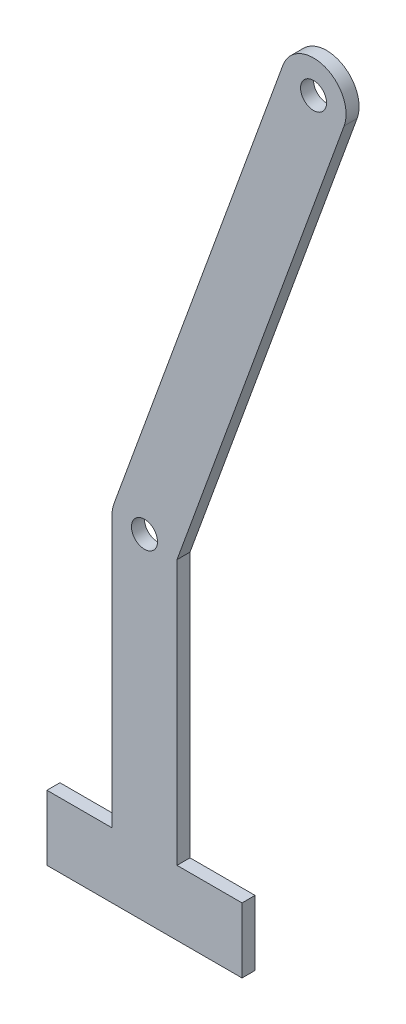
from build123d import *

# Parameters (mm, degrees)
SKETCH1_R           = 2.54
BOSS_EXTRUDE1_DEPTH = 2.54


with BuildPart() as part:
    # Sketch1 → Boss-Extrude1 (new body)
    with BuildSketch(Plane.XY):
        with BuildLine():
            Line((-54.601784234, -110.868808086), (-21.972951858, -21.22182791))
            ThreePointArc((-21.972951858, -21.22182791), (-25.76817209, -13.082951858), (-33.907048142, -16.87817209))
            Line((-33.907048142, -16.87817209), (-66.918832376, -107.577303848))
            ThreePointArc((-66.918832376, -107.577303848), (-67.205313465, -108.64646583), (-67.301784234, -109.749131758))
            Line((-67.301784234, -109.749131758), (-67.301784234, -162.56))
            Line((-67.301784234, -162.56), (-80.001784234, -162.56))
            Line((-80.001784234, -162.56), (-80.001784234, -175.26))
            Line((-80.001784234, -175.26), (-41.901784234, -175.26))
            Line((-41.901784234, -175.26), (-41.901784234, -162.56))
            Line((-41.901784234, -162.56), (-54.601784234, -162.56))
            Line((-54.601784234, -162.56), (-54.601784234, -110.868808086))
        make_face()
        with Locations((-60.951784234, -109.749131758)):
            Circle(SKETCH1_R, mode=Mode.SUBTRACT)
        with Locations((-27.94, -19.05)):
            Circle(SKETCH1_R, mode=Mode.SUBTRACT)
    extrude(amount=BOSS_EXTRUDE1_DEPTH)


solid = part.part
